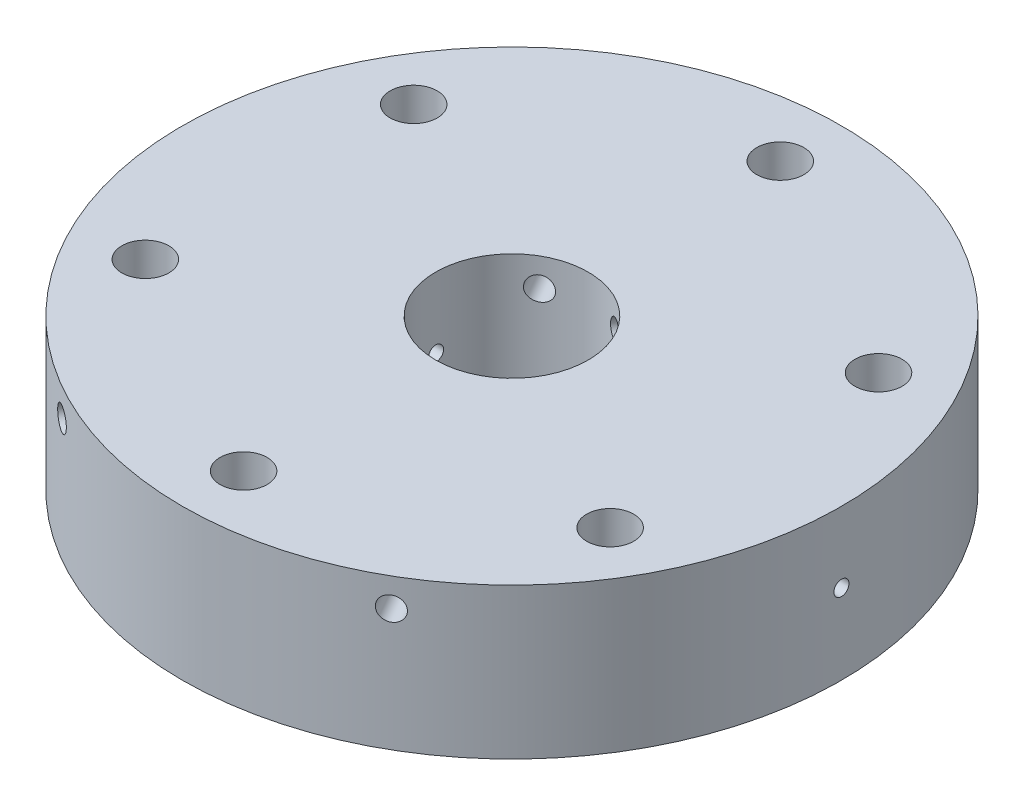
from build123d import *

# Parameters (mm, degrees)
SKETCH1_R                            = 88.9
BOSS_EXTRUDE1_DEPTH                  = 40.64
SKETCH2_R                            = 20.574
CUT_EXTRUDE1_DEPTH                   = 133.128837125
CUT_EXTRUDE4_DEPTH                   = 133.128837125
CUT_EXTRUDE4_DEPTH_BACK              = 133.128837125
SKETCH3_R                            = 2.032
SKETCH6_R                            = 3.175
CUT_EXTRUDE5_DEPTH                   = 133.128837291
F_1_2_0_5_DIAMETER_HOLE1_D           = 12.7
F_1_2_0_5_DIAMETER_HOLE1_CSINK_D     = 13.97
F_1_2_0_5_DIAMETER_HOLE1_CSINK_ANGLE = 90
CIRPATTERN1_COUNT                    = 6
SKETCH9_W                            = 10.16
SKETCH9_H                            = 5.08


with BuildPart() as part:
    # Sketch1 → Boss-Extrude1 (new body)
    with BuildSketch(Plane(origin=(0, 0, 0), x_dir=(1, 0, 0), z_dir=(0, 1, 0))):
        Circle(SKETCH1_R)
    extrude(amount=BOSS_EXTRUDE1_DEPTH)

    # Sketch2 → Cut-Extrude1 (cut, through all)
    with BuildSketch(Plane(origin=(0, 40.64, 0), x_dir=(1, 0, 0), z_dir=(0, 1, 0))):
        Circle(SKETCH2_R)
    extrude(amount=-CUT_EXTRUDE1_DEPTH, mode=Mode.SUBTRACT)

    # Sketch3 → Cut-Extrude4 (cut, two sides: drawn at the far end of the back side and taken through both)
    with BuildSketch(Plane(origin=(0, 0, 0), x_dir=(0, 0, -1), z_dir=(1, 0, 0)).offset(-CUT_EXTRUDE4_DEPTH_BACK)):
        with Locations((0, 21.59)):
            Circle(SKETCH3_R)
    extrude(amount=CUT_EXTRUDE4_DEPTH + CUT_EXTRUDE4_DEPTH_BACK, mode=Mode.SUBTRACT)

    # Sketch6 → Cut-Extrude5 (cut, symmetric)
    with BuildSketch(Plane(origin=(0, 0, 0), x_dir=(0, 1, 0), z_dir=(0.499999999999998, 0, -0.8660254037844398))):
        with Locations((33.02, 0)):
            Circle(SKETCH6_R)
    cut_extrude5 = extrude(amount=CUT_EXTRUDE5_DEPTH, both=True, mode=Mode.SUBTRACT)

    # Mirror1: Cut-Extrude5 across plane
    add(cut_extrude5.mirror(Plane.XY), mode=Mode.SUBTRACT)

    # 1/2 (0.5) Diameter Hole1 (through all)
    with Locations(Plane(origin=(0, 0, 72.39), x_dir=(0, 0, -1), z_dir=(0, -1, 0))):
        with Locations((0, 0)):
            f_1_2_0_5_diameter_hole1 = CounterSinkHole(F_1_2_0_5_DIAMETER_HOLE1_D / 2, F_1_2_0_5_DIAMETER_HOLE1_CSINK_D / 2, counter_sink_angle=F_1_2_0_5_DIAMETER_HOLE1_CSINK_ANGLE)

    # CirPattern1: 1/2 (0.5) Diameter Hole1 ×6 about axis
    cirpattern1_axis = Axis((0, 0, 0), (0, 1, 0))
    for i in range(1, CIRPATTERN1_COUNT):
        add(f_1_2_0_5_diameter_hole1.rotate(cirpattern1_axis, i * 360 / CIRPATTERN1_COUNT), mode=Mode.SUBTRACT)

    # Sketch9 → Cut-Revolve1 (revolve, cut)
    with BuildSketch(Plane.XY):
        with Locations((50.8, 2.54)):
            Rectangle(SKETCH9_W, SKETCH9_H)
    revolve(axis=Axis((0, 40.64, 0), (0, -1, 0)), mode=Mode.SUBTRACT)


solid = part.part
